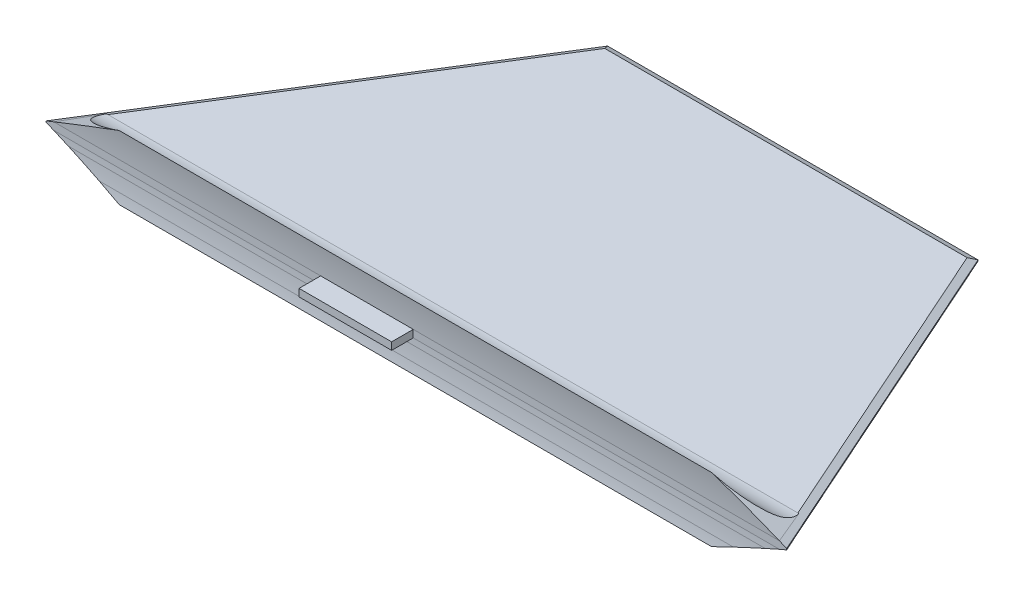
from build123d import *
from OCP.BRepFilletAPI import BRepFilletAPI_MakeChamfer

# Parameters (mm, degrees)
BOSS_EXTRUDE1_DEPTH      = 3.048
CHAMFER1_SIZE            = 1.27
CHAMFER1_SIZE2           = 2.723523789
BOSS_EXTRUDE2_DEPTH      = 304.8
LEADING_SIDE_DEPTH       = 337.678601078
LEADING_SIDE_DEPTH_BACK  = 337.678601078
TRAILING_SIDE_DEPTH      = 254
TRAILING_SIDE_DEPTH_BACK = 27.94


# Read off the part's stored shape, not the designer's step: Boss-Extrude2
with BuildPart() as part:
    # Sketch1 → Boss-Extrude1 (new body)
    with BuildSketch(Plane(origin=(0, 0, 0), x_dir=(1, 0, 0), z_dir=(0, 1, 0))):
        Polygon((0, 0), (88.9, 142.24), (241.3, 142.24), (304.8, 0), (151.13, 0), (151.13, -8.89), (113.03, -8.89), (113.03, 0), align=None)
    extrude(amount=BOSS_EXTRUDE1_DEPTH)

    # Chamfer1: one chamfer whose edges measure the first distance from different faces: ONE call of the kernel's chamfer builder (chamfer() names one face for all edges)
    chamfer1_edges_1 = [part.edges().sort_by_distance(p)[0] for p in [
        (273.05, 3.048, -71.12),
        (273.05, 0, -71.12),
    ]]
    chamfer1_side_1 = [part.faces().sort_by_distance(p)[0] for p in [
        (273.05, 1.524, -71.12),
    ]]
    chamfer1_edges_2 = [part.edges().sort_by_distance(p)[0] for p in [
        (165.1, 3.048, -142.24),
        (165.1, 0, -142.24),
    ]]
    chamfer1_side_2 = [part.faces().sort_by_distance(p)[0] for p in [
        (165.1, 1.524, -142.24),
    ]]
    chamfer1_edges_3 = [part.edges().sort_by_distance(p)[0] for p in [
        (44.45, 3.048, -71.12),
        (44.45, 0, -71.12),
    ]]
    chamfer1_side_3 = [part.faces().sort_by_distance(p)[0] for p in [
        (44.45, 1.524, -71.12),
    ]]
    chamfer1 = BRepFilletAPI_MakeChamfer(part.part.solid().wrapped)
    for e in chamfer1_edges_1:
        chamfer1.Add(CHAMFER1_SIZE, CHAMFER1_SIZE2, e.wrapped, chamfer1_side_1[0].wrapped)  # the first distance lies on this face
    for e in chamfer1_edges_2:
        chamfer1.Add(CHAMFER1_SIZE, CHAMFER1_SIZE2, e.wrapped, chamfer1_side_2[0].wrapped)  # the first distance lies on this face
    for e in chamfer1_edges_3:
        chamfer1.Add(CHAMFER1_SIZE, CHAMFER1_SIZE2, e.wrapped, chamfer1_side_3[0].wrapped)  # the first distance lies on this face
    add(Compound.cast(chamfer1.Shape()), mode=Mode.REPLACE)

    # Boss-Extrude2 outline → Boss-Extrude2 (add)
    with BuildSketch(Plane(origin=(0, 0, 0), x_dir=(0, 0, -1), z_dir=(1, 0, 0))):
        with BuildLine():
            add(Edge.make_bspline(
                [(-1.319449565, -11.69047888), (-1.083912463, -10.452594474), (-0.880163154, -9.208724492), (-0.706755386, -7.960561287)],
                knots=[0, 0, 0, 0, 0.321044666, 0.321044666, 0.321044666, 0.321044666], degree=3))
            add(Edge.make_bspline(
                [(13.71197658, 0), (11.02178845, -0.093200554), (7.303438621, -1.100845461), (2.014457887, -5.338152095), (-0.385242208, -8.714114828), (-1.319449565, -11.69047888)],
                knots=[0, 0, 0, 0, 0.400857747, 0.544791842, 1, 1, 1, 1], degree=3))
            Line((13.71197658, 0), (0, 0))
            add(Edge.make_bspline(
                [(-0.137299539, -2.479180327), (-0.079487033, -1.653414855), (-0.033857167, -0.826861513), (0, 0)],
                knots=[0.789109162, 0.789109162, 0.789109162, 0.789109162, 1, 1, 1, 1], degree=3))
            ThreePointArc((-0.137299539, -2.479180327), (-0.3738253, -5.224878487), (-0.706755386, -7.960561287))
        make_face()
        with BuildLine():
            Line((0, 3.048), (13.71197658, 3.048))
            add(Edge.make_bspline(
                [(13.71197658, 3.048), (11.02178845, 3.141200554), (7.303438621, 4.148845461), (2.014457887, 8.386152095), (-0.385242208, 11.762114828), (-1.319449565, 14.73847888)],
                knots=[0, 0, 0, 0, 0.400857747, 0.544791842, 1, 1, 1, 1], degree=3))
            add(Edge.make_bspline(
                [(-1.319449565, 14.73847888), (-0.58579121, 10.882677695), (-0.160543563, 6.9688034), (0, 3.048)],
                knots=[0, 0, 0, 0, 1, 1, 1, 1], degree=3))
        make_face()
    extrude(amount=BOSS_EXTRUDE2_DEPTH)

    # Sketch4 → Leading Side (cut, two sides: drawn at the far end of the back side and taken through both)
    with BuildSketch(Plane(origin=(0, 0, 0), x_dir=(0, -1, 0), z_dir=(-0.5038644349256837, 0, 0.8637827453804698)).offset(-LEADING_SIDE_DEPTH_BACK)):
        Polygon((0, -7.461077899), (0, 2.774218822), (11.69047888, 27.844531684), (11.69047888, -6.284577832), align=None)
        Polygon((-14.73847888, 27.844531684), (-14.73847888, -6.284577832), (-3.048, -7.461077899), (-3.048, 2.774218822), align=None)
    extrude(amount=LEADING_SIDE_DEPTH + LEADING_SIDE_DEPTH_BACK, mode=Mode.SUBTRACT)

    # Sketch6 → Trailing Side (cut, two sides: drawn at the far end of the back side and taken through both)
    with BuildSketch(Plane(origin=(45.089267536, 0, 108.213523637), x_dir=(0, -1, 0), z_dir=(-0.384617560400187, 0, -0.9230760164969126)).offset(-TRAILING_SIDE_DEPTH_BACK)):
        Polygon((0, -286.627436809), (0, -278.59888787), (11.69047888, -253.528575007), (11.69047888, -287.965550571), align=None)
        Polygon((-14.73847888, -253.528575007), (-14.73847888, -287.965550571), (-3.048, -286.627436809), (-3.048, -278.600404574), align=None)
    extrude(amount=TRAILING_SIDE_DEPTH + TRAILING_SIDE_DEPTH_BACK, mode=Mode.SUBTRACT)


solid = part.part
